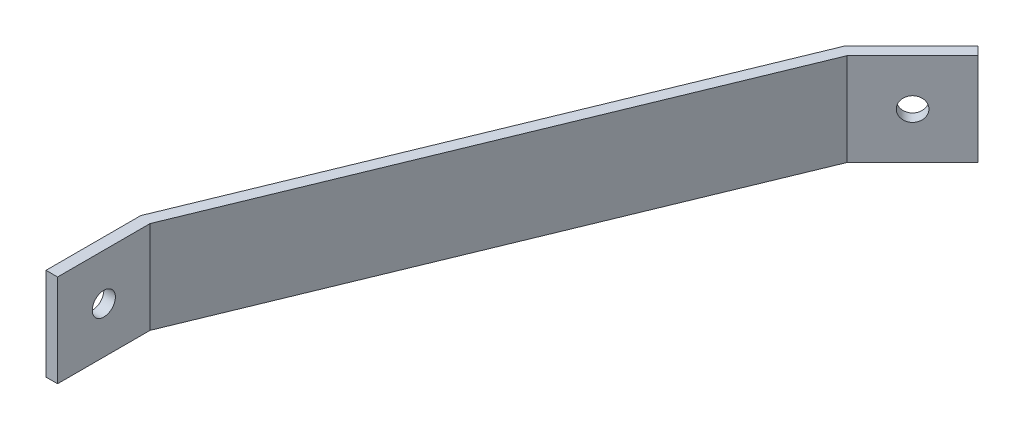
from build123d import *

# Parameters (mm, degrees)
EXTRUDE_THIN1_DEPTH = 12.7
SKETCH4_R           = 3.175
CUT_EXTRUDE2_DEPTH  = 845.682206476
F_3DSKETCH1_R       = 3.175
CUT_EXTRUDE3_DEPTH  = 10


with BuildPart() as part:
    # Sketch2 → Extrude-Thin1 (new, symmetric)
    with BuildSketch(Plane(origin=(0, 788.304423502, 0), x_dir=(1, 0, 0), z_dir=(0, 1, 0))):
        Polygon((80.319971491, -189.595580889), (62.359459249, -207.556093131), (6.588428726, -343.172904376), (6.588428726, -368.572904376), (3.413428726, -368.572904376), (3.413428726, -342.545549877), (59.664858338, -205.760565981), (78.074907461, -187.350516858), align=None)
    extrude(amount=EXTRUDE_THIN1_DEPTH, both=True)

    # Sketch4 → Cut-Extrude2 (cut, through all)
    with BuildSketch(Plane(origin=(134.95777619, 0, 134.95777619), x_dir=(0.7071067811865479, 0, -0.7071067811865472), z_dir=(0.7071067811865472, 0, 0.7071067811865479))):
        with Locations((-89.969524424, 788.304423502)):
            Circle(SKETCH4_R)
    extrude(amount=-CUT_EXTRUDE2_DEPTH, mode=Mode.SUBTRACT)

    # 3DSketch1 → Cut-Extrude3 (cut)
    with BuildSketch(Plane(origin=(6.588428726, 788.304423502, 355.872904376), x_dir=(0, 0, 1), z_dir=(1, 0, 0))):
        Circle(F_3DSKETCH1_R)
    extrude(amount=-CUT_EXTRUDE3_DEPTH, mode=Mode.SUBTRACT)


solid = part.part
